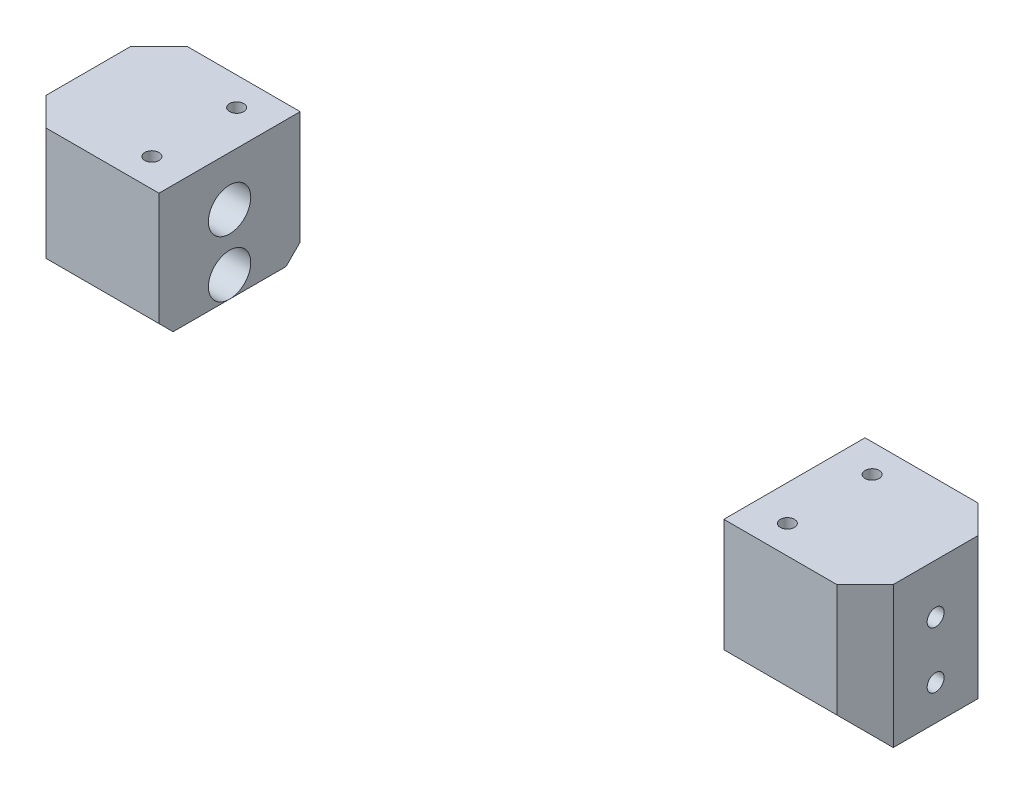
from build123d import *

# Parameters (mm, degrees)
SKETCH_1_W          = 60
SKETCH_1_H          = 10
EXTRUDE_1_DEPTH     = 10
SKETCH_2_R          = 0.6
CUT_EXTRUDE_1_DEPTH = 62.032778079
SKETCH_5_R          = 0.5
CUT_EXTRUDE_3_DEPTH = 33.015621187
CHAMFER_2_SIZE      = 2
CHAMFER_3_SIZE      = 2
SKETCH_6_W          = 40
SKETCH_6_H          = 10
CUT_EXTRUDE_4_DEPTH = 33.015621187
CHAMFER_6_SIZE      = 1
CHAMFER_7_SIZE      = 1
CHAMFER_7_SIZE2     = 0.577350269
SKETCH_7_R          = 1.5
CUT_EXTRUDE_6_DEPTH = 5
SKETCH_8_R          = 1.5
CUT_EXTRUDE_9_DEPTH = 5


with BuildPart() as part:
    # 草图1 → 凸台-拉伸1 (new body)
    with BuildSketch(Plane(origin=(0, 0, 0), x_dir=(1, 0, 0), z_dir=(0, 1, 0))):
        Rectangle(SKETCH_1_W, SKETCH_1_H)
    extrude(amount=EXTRUDE_1_DEPTH)

    # 草图2 → 切除-拉伸1 (cut, through all)
    with BuildSketch(Plane.ZY.offset(30)):
        with Locations((0, 6.5)):
            Circle(SKETCH_2_R)
        with Locations((0, 2.5)):
            Circle(SKETCH_2_R)
    extrude(amount=-CUT_EXTRUDE_1_DEPTH, mode=Mode.SUBTRACT)

    # 草图5 → 切除-拉伸3 (cut, through all)
    with BuildSketch(Plane(origin=(0, 10, 0), x_dir=(1, 0, 0), z_dir=(0, 1, 0))):
        with Locations(Location((-22.5, 3, 0), (0, 0, 270))):
            Circle(SKETCH_5_R)
        with Locations(Location((-22.5, -3, 0), (0, 0, 90))):
            Circle(SKETCH_5_R)
        with Locations(Location((22.5, -3, 0), (0, 0, 270))):
            Circle(SKETCH_5_R)
        with Locations(Location((22.5, 3, 0), (0, 0, 90))):
            Circle(SKETCH_5_R)
    extrude(amount=-CUT_EXTRUDE_3_DEPTH, mode=Mode.SUBTRACT)

    # 倒角2
    # the kernel refuses this chamfer: 2 mm, written as the material it takes off along each edge
    with BuildSketch(Plane(origin=(-35.143365976, 0, -5), x_dir=(0, -0.027495876610586372, 0.9996219169112968), z_dir=(1, 0, 0))) as chamfer_2_piece_1:
        Polygon((CHAMFER_2_SIZE * 0.999621916911, -CHAMFER_2_SIZE * 0.0274958766106), (-CHAMFER_2_SIZE * 0.0274958766106, -CHAMFER_2_SIZE * 0.999621916911), (0, 0), align=None)
    extrude(amount=70.286731952, mode=Mode.SUBTRACT)
    with BuildSketch(Plane(origin=(35.143365976, 0, 5), x_dir=(0, 0.9996219169112968, 0.027495876610586494), z_dir=(-1, 0, 0))) as chamfer_2_piece_2:
        Polygon((CHAMFER_2_SIZE * 0.999621916911, CHAMFER_2_SIZE * 0.0274958766106), (-CHAMFER_2_SIZE * 0.0274958766106, CHAMFER_2_SIZE * 0.999621916911), (0, 0), align=None)
    extrude(amount=70.286731952, mode=Mode.SUBTRACT)

    # 倒角3
    chamfer_3_edges = [part.edges().sort_by_distance(p)[0] for p in [
        (-30, 6, -5),
        (-30, 6, 5),
        (30, 6, 5),
        (30, 6, -5),
    ]]
    chamfer(chamfer_3_edges, length=CHAMFER_3_SIZE)

    # 草图6 → 切除-拉伸4 (cut, through all)
    with BuildSketch(Plane(origin=(0, 10, 0), x_dir=(1, 0, 0), z_dir=(0, 1, 0))):
        Rectangle(SKETCH_6_W, SKETCH_6_H)
    extrude(amount=-CUT_EXTRUDE_4_DEPTH, mode=Mode.SUBTRACT)


with BuildPart() as cut_extrude_4_piece_1:
    # of the separate pieces the step leaves, piece 1, a body of its own (cut_extrude_4_pieces)
    add(part.part.solids().sort_by_distance((-20, 2, 5))[0])

    # 倒角6
    chamfer_6_edges = [cut_extrude_4_piece_1.edges().sort_by_distance(p)[0] for p in [
        (-20, 0, 0),
    ]]
    chamfer(chamfer_6_edges, length=CHAMFER_6_SIZE)

    # 草图7 → 切除-拉伸6 (cut)
    with BuildSketch(Plane(origin=(-20, 0, 0), x_dir=(0, 0, -1), z_dir=(1, 0, 0))):
        with Locations((0, 6.5)):
            Circle(SKETCH_7_R)
        with Locations((0, 2.5)):
            Circle(SKETCH_7_R)
    extrude(amount=-CUT_EXTRUDE_6_DEPTH, mode=Mode.SUBTRACT)


with BuildPart() as cut_extrude_4_piece_2:
    # of the separate pieces the step leaves, piece 2, a body of its own (cut_extrude_4_pieces)
    add(part.part.solids().sort_by_distance((28, 2, 5))[0])

    # 倒角7
    chamfer_7_edges = [cut_extrude_4_piece_2.edges().sort_by_distance(p)[0] for p in [
        (20, 0, 0),
    ]]
    chamfer_7_side = [cut_extrude_4_piece_2.faces().sort_by_distance(p)[0] for p in [
        (20, 5.196977706, 0),
    ]]
    chamfer(chamfer_7_edges, length=CHAMFER_7_SIZE, length2=CHAMFER_7_SIZE2, reference=chamfer_7_side[0])

    # 草图8 → 切除-拉伸9 (cut)
    with BuildSketch(Plane(origin=(20, 0, 0), x_dir=(0, 0, -1), z_dir=(1, 0, 0))):
        with Locations((0, 6.5)):
            Circle(SKETCH_8_R)
        with Locations((0, 2.5)):
            Circle(SKETCH_8_R)
    extrude(amount=CUT_EXTRUDE_9_DEPTH, mode=Mode.SUBTRACT)


solid = Compound([cut_extrude_4_piece_1.part, cut_extrude_4_piece_2.part])
